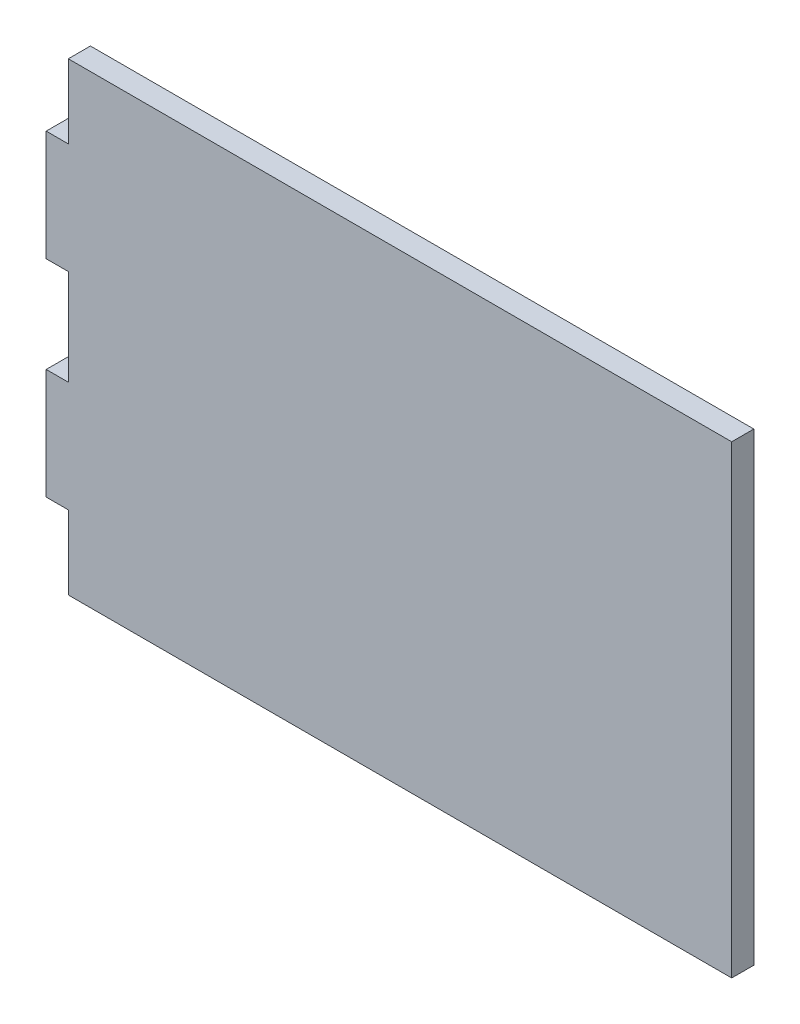
from build123d import *

# Parameters (mm, degrees)
BOSS_EXTRUDE1_DEPTH = 1.5


with BuildPart() as part:
    # Sketch1 → Boss-Extrude1 (new, symmetric)
    with BuildSketch(Plane.XY):
        Polygon((-45, -21.5), (-45, -31.5), (45, -31.5), (45, 31.5), (-45, 31.5), (-45, 21.5), (-48, 21.5), (-48, 6.5), (-45, 6.5), (-45, -6.5), (-48, -6.5), (-48, -21.5), align=None)
    extrude(amount=BOSS_EXTRUDE1_DEPTH, both=True)


solid = part.part
